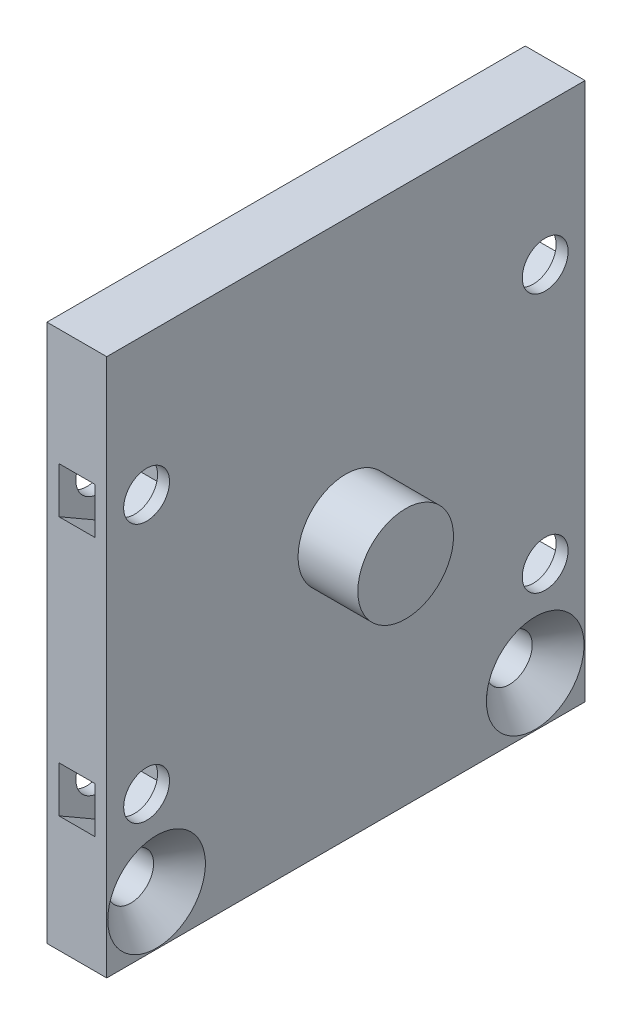
from build123d import *

# Parameters (mm, degrees)
SKETCH1_W           = 24
SKETCH1_H           = 27
SKETCH1_R           = 1.15
BOSS_EXTRUDE1_DEPTH = 3
SKETCH2_R           = 2.4
BOSS_EXTRUDE2_DEPTH = 3
CHAMFER1_SIZE       = 1.3
SKETCH3_R           = 1.15
CUT_EXTRUDE1_DEPTH  = 3
CUT_EXTRUDE2_START  = 0.6
CUT_EXTRUDE2_DEPTH  = 1.8


with BuildPart() as part:
    # Sketch1 → Boss-Extrude1 (new body)
    with BuildSketch(Plane(origin=(0, 0, 0), x_dir=(0, 0, -1), z_dir=(1, 0, 0))):
        Rectangle(SKETCH1_W, SKETCH1_H)
        with Locations((-9.5, -11)):
            Circle(SKETCH1_R, mode=Mode.SUBTRACT)
        with Locations((9.5, -11)):
            Circle(SKETCH1_R, mode=Mode.SUBTRACT)
    extrude(amount=BOSS_EXTRUDE1_DEPTH)

    # Sketch2 → Boss-Extrude2 (add)
    with BuildSketch(Plane(origin=(3, 0, 0), x_dir=(0, 0, -1), z_dir=(1, 0, 0))):
        Circle(SKETCH2_R)
    extrude(amount=BOSS_EXTRUDE2_DEPTH)

    # Chamfer1
    chamfer1_edges = [part.edges().sort_by_distance(p)[0] for p in [
        (3, -11, -8.35),
        (3, -11, 10.65),
    ]]
    chamfer(chamfer1_edges, length=CHAMFER1_SIZE)

    # Sketch3 → Cut-Extrude1 (cut)
    with BuildSketch(Plane(origin=(0, 0, 0), x_dir=(0, 0, -1), z_dir=(1, 0, 0))):
        with Locations((-10, 6.5)):
            Circle(SKETCH3_R)
        with Locations((-10, -6.5)):
            Circle(SKETCH3_R)
        with Locations((10, -6.5)):
            Circle(SKETCH3_R)
        with Locations((10, 6.5)):
            Circle(SKETCH3_R)
    extrude(amount=CUT_EXTRUDE1_DEPTH, mode=Mode.SUBTRACT)

    # Sketch4 → Cut-Extrude2 (cut)
    with BuildSketch(Plane(origin=(0, 0, 0), x_dir=(0, 0, -1), z_dir=(1, 0, 0)).offset(CUT_EXTRUDE2_START)):
        Polygon((-10, 4.190598923), (-8, 5.345299462), (-8, 7.654700538), (-10, 8.809401077), (-12, 7.654700538), (-12, 5.345299462), align=None)
        Polygon((-10, -4.190598923), (-12, -5.345299462), (-12, -7.654700538), (-10, -8.809401077), (-8, -7.654700538), (-8, -5.345299462), align=None)
        Polygon((10, -4.190598923), (8, -5.345299462), (8, -7.654700538), (10, -8.809401077), (12, -7.654700538), (12, -5.345299462), align=None)
        Polygon((10, 8.809401077), (8, 7.654700538), (8, 5.345299462), (10, 4.190598923), (12, 5.345299462), (12, 7.654700538), align=None)
    extrude(amount=CUT_EXTRUDE2_DEPTH, mode=Mode.SUBTRACT)


solid = part.part
